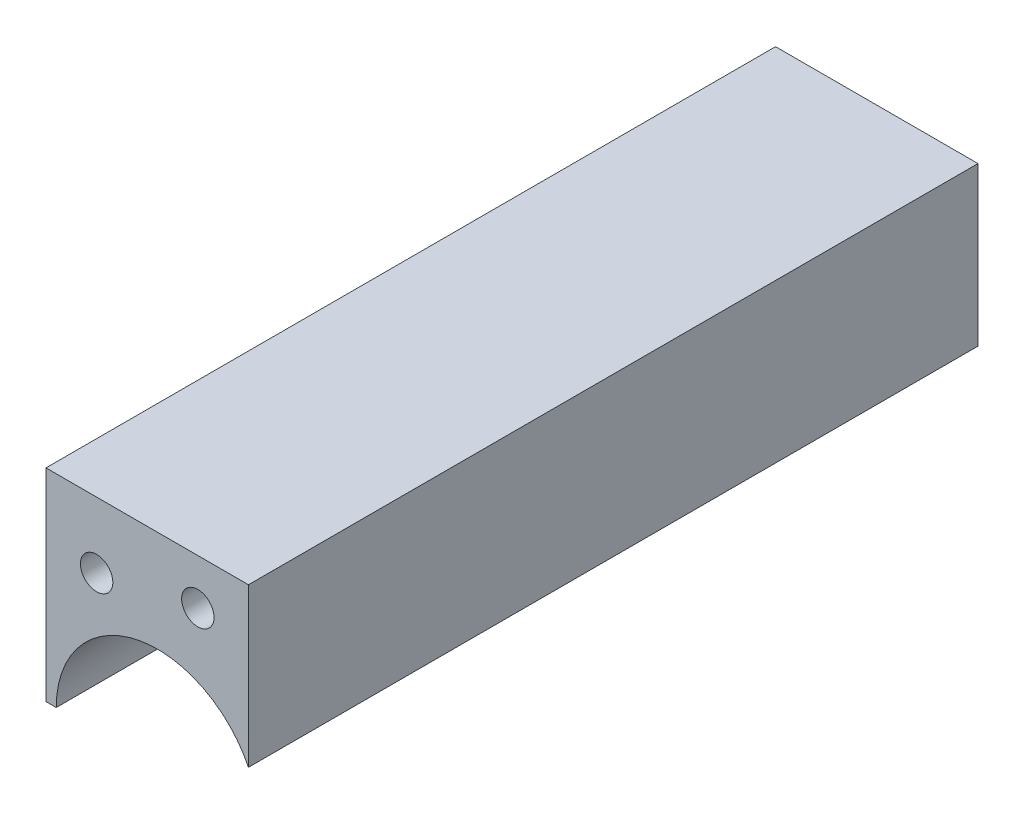
from build123d import *

# Parameters (mm, degrees)
SKETCH1_R           = 1.6
BOSS_EXTRUDE2_DEPTH = 72.07


with BuildPart() as part:
    # Sketch1 → Boss-Extrude2 (new body)
    with BuildSketch(Plane.XY):
        with BuildLine():
            Line((0, 0), (1.01, 0))
            ThreePointArc((1.01, 0), (8.762779495, 9.744229061), (20, 4.379486271))
            Line((20, 4.379486271), (20, 20))
            Line((20, 20), (0, 20))
            Line((0, 20), (0, 0))
        make_face()
        with Locations((5, 13.5)):
            Circle(SKETCH1_R, mode=Mode.SUBTRACT)
        with Locations((15, 15.5)):
            Circle(SKETCH1_R, mode=Mode.SUBTRACT)
    extrude(amount=BOSS_EXTRUDE2_DEPTH)


solid = part.part
